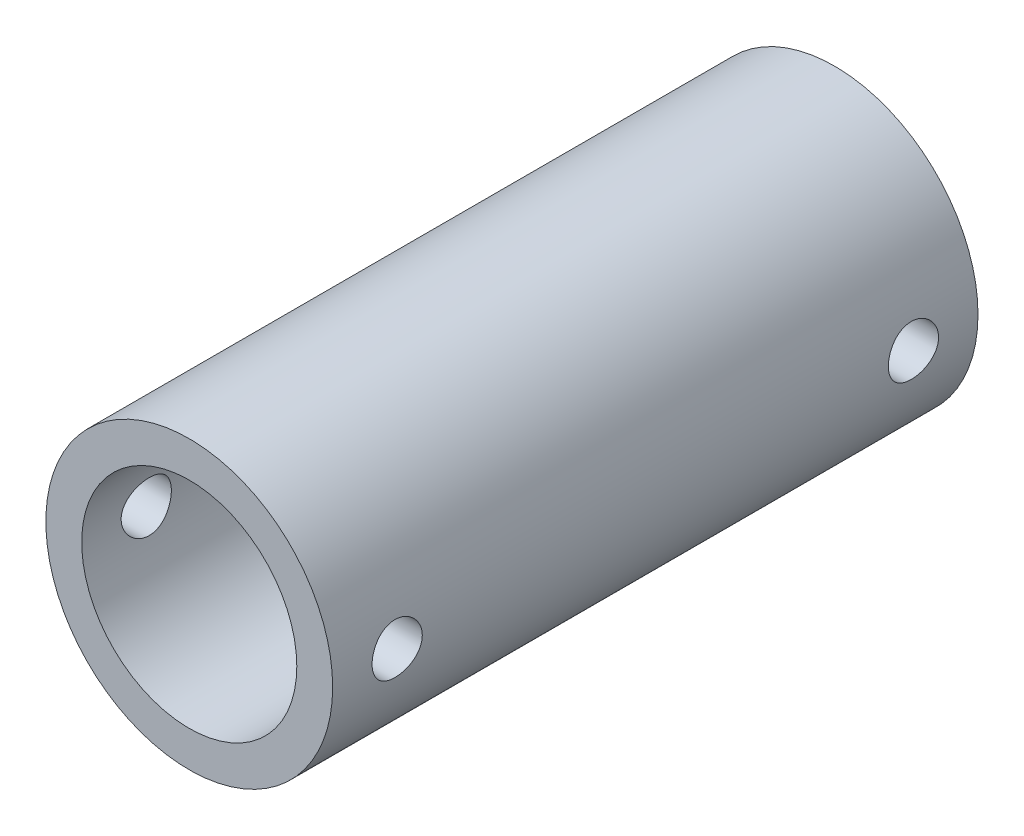
from build123d import *

# Parameters (mm, degrees)
SKETCH1_R               = 40
SKETCH1_R_2             = 30
BOSS_EXTRUDE1_DEPTH     = 90
CUT_EXTRUDE1_DEPTH      = 107.301458127
CUT_EXTRUDE1_DEPTH_BACK = 107.301458127
SKETCH2_R               = 7


with BuildPart() as part:
    # Sketch1 → Boss-Extrude1 (new, symmetric)
    with BuildSketch(Plane.XY):
        Circle(SKETCH1_R)
        Circle(SKETCH1_R_2, mode=Mode.SUBTRACT)
    extrude(amount=BOSS_EXTRUDE1_DEPTH, both=True)

    # Sketch2 → Cut-Extrude1 (cut, two sides: drawn at the far end of the back side and taken through both)
    with BuildSketch(Plane(origin=(0, 0, 0), x_dir=(0, 0, -1), z_dir=(1, 0, 0)).offset(-CUT_EXTRUDE1_DEPTH_BACK)):
        with Locations((-72, 0)):
            Circle(SKETCH2_R)
        with Locations((72, 0)):
            Circle(SKETCH2_R)
    extrude(amount=CUT_EXTRUDE1_DEPTH + CUT_EXTRUDE1_DEPTH_BACK, mode=Mode.SUBTRACT)


solid = part.part
